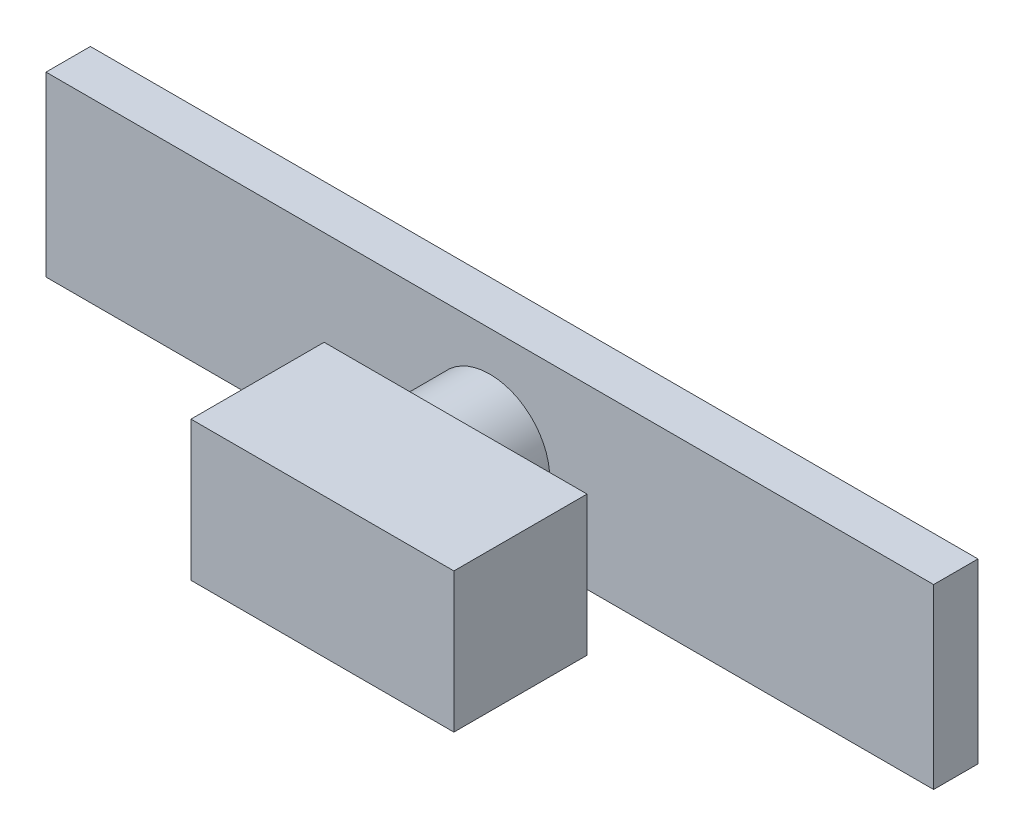
from build123d import *

# Parameters (mm, degrees)
SKETCH2_W             = 254
SKETCH2_H             = 12.7
BOSS_EXTRUDE1_DEPTH   = 50.8
SKETCH3_R             = 17.140791438
BOSS_EXTRUDE2_DEPTH   = 19.05
SKETCH4_W             = 75.235944222
SKETCH4_H             = 39.955088207
BOSS_EXTRUDE3_DEPTH   = 38.1
SCALE2_SCALE          = 0.06
BODY_MOVE_COPY1_ANGLE = 90
SCALE5_SCALE          = 0.25


with BuildPart() as part:
    # Sketch2 → Boss-Extrude1 (new body)
    with BuildSketch(Plane.XY):
        with Locations((79.130769231, 14.898076923)):
            Rectangle(SKETCH2_W, SKETCH2_H)
    extrude(amount=BOSS_EXTRUDE1_DEPTH)

    # Sketch3 → Boss-Extrude2 (add)
    with BuildSketch(Plane(origin=(0, 21.248076923, 0), x_dir=(1, 0, 0), z_dir=(0, 1, 0))):
        with Locations((79.130769231, -28.483063876)):
            Circle(SKETCH3_R)
    extrude(amount=BOSS_EXTRUDE2_DEPTH)

    # Sketch4 → Boss-Extrude3 (add)
    with BuildSketch(Plane(origin=(0, 40.298076923, 0), x_dir=(1, 0, 0), z_dir=(0, 1, 0))):
        with Locations((88.38546847, -28.088530296)):
            Rectangle(SKETCH4_W, SKETCH4_H)
    extrude(amount=BOSS_EXTRUDE3_DEPTH)


with BuildPart() as part_1:
    # Scale2: scaled about (82.711857342, 33.041003565, 26.623476887)
    add(part.part.scale(SCALE2_SCALE).moved(Location((77.749145901, 31.058543351, 25.026068274))))


with BuildPart() as part_2:
    # Body-Move/Copy1: moved
    add(part_1.part.rotate(Axis((0, 33.666927966, 26.550068274), (1, 0, 0)), BODY_MOVE_COPY1_ANGLE))


with BuildPart() as part_3:
    # Body-Move/Copy3: moved
    add(part_2.part.moved(Location((-50.8, 0, -50.8))))


with BuildPart() as part_4:
    # Scale5: scaled about (31.911857342, 33.593519353, -24.875856127)
    add(part_3.part.scale(SCALE5_SCALE).moved(Location((23.933893006, 25.195139515, -18.656892095))))


with BuildPart() as part_5:
    # Body-Move/Copy9: moved
    add(part_4.part.moved(Location((-50.8, 0, 0))))


with BuildPart() as part_6:
    # Body-Move/Copy11: moved
    add(part_5.part.moved(Location((0, 0, -50.8))))


with BuildPart() as part_7:
    # Body-Move/Copy12: moved
    add(part_6.part.moved(Location((0, 0, -127))))


solid = part_7.part
